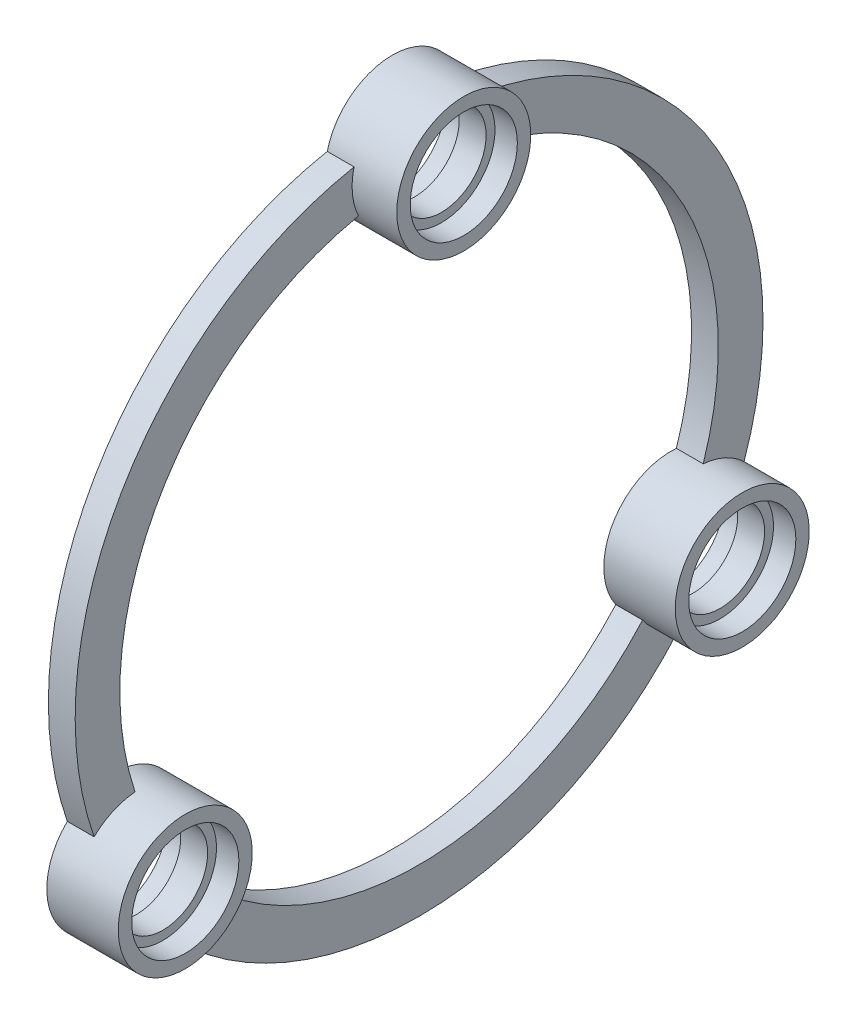
from build123d import *

# Parameters (mm, degrees)
SKETCH_1_R               = 38.5
SKETCH_1_R_2             = 33.5
EXTRUDE_1_DEPTH          = 3
SKETCH_2_R               = 7.5
EXTRUDE_2_DEPTH          = 8
SKETCH_4_R               = 5
CUT_EXTRUDE_1_DEPTH      = 59.638724406
SKETCH_5_R               = 6
CUT_EXTRUDE_2_DEPTH      = 2.5
CUT_EXTRUDE_START        = -2.5
SKETCH_6_R               = 6
CUT_EXTRUDE_3_DEPTH      = 2.5
PATTERN_CIRCULAR_1_COUNT = 3


with BuildPart() as part:
    # Эскиз1 → Бобышка-Вытянуть1 (new body)
    with BuildSketch(Plane(origin=(0, 0, 0), x_dir=(0, 0, -1), z_dir=(1, 0, 0))):
        Circle(SKETCH_1_R)
        Circle(SKETCH_1_R_2, mode=Mode.SUBTRACT)
    extrude(amount=EXTRUDE_1_DEPTH)

    # Эскиз2 → Бобышка-Вытянуть2 (add)
    with BuildSketch(Plane.ZY):
        with Locations((0, 36)):
            Circle(SKETCH_2_R)
    extrude_2 = extrude(amount=-EXTRUDE_2_DEPTH)

    # Эскиз4 → Вырез-Вытянуть1 (cut, through all)
    with BuildSketch(Plane.ZY):
        with Locations((0, 36)):
            Circle(SKETCH_4_R)
    cut_extrude_1 = extrude(amount=-CUT_EXTRUDE_1_DEPTH, mode=Mode.SUBTRACT)

    # Эскиз5 → Вырез-Вытянуть2 (cut)
    with BuildSketch(Plane.ZY):
        with Locations((0, 36)):
            Circle(SKETCH_5_R)
    cut_extrude_2 = extrude(amount=-CUT_EXTRUDE_2_DEPTH, mode=Mode.SUBTRACT)

    # Эскиз6 → Вырез-Вытянуть3 (cut)
    with BuildSketch(Plane(origin=(8, 0, 0), x_dir=(0, 0, -1), z_dir=(1, 0, 0)).offset(CUT_EXTRUDE_START)):
        with Locations((0, 36)):
            Circle(SKETCH_6_R)
    cut_extrude_3 = extrude(amount=CUT_EXTRUDE_3_DEPTH, mode=Mode.SUBTRACT)

    # Круговой массив1: Бобышка-Вытянуть2, Вырез-Вытянуть1, Вырез-Вытянуть2, Вырез-Вытянуть3 ×3 about axis
    pattern_circular_1_axis = Axis((3, 0, 0), (-1, 0, 0))
    add([extrude_2.rotate(pattern_circular_1_axis, i * 360 / PATTERN_CIRCULAR_1_COUNT) for i in range(1, PATTERN_CIRCULAR_1_COUNT)])
    add([cut_extrude_1.rotate(pattern_circular_1_axis, i * 360 / PATTERN_CIRCULAR_1_COUNT) for i in range(1, PATTERN_CIRCULAR_1_COUNT)], mode=Mode.SUBTRACT)
    add([cut_extrude_2.rotate(pattern_circular_1_axis, i * 360 / PATTERN_CIRCULAR_1_COUNT) for i in range(1, PATTERN_CIRCULAR_1_COUNT)], mode=Mode.SUBTRACT)
    add([cut_extrude_3.rotate(pattern_circular_1_axis, i * 360 / PATTERN_CIRCULAR_1_COUNT) for i in range(1, PATTERN_CIRCULAR_1_COUNT)], mode=Mode.SUBTRACT)


solid = part.part
